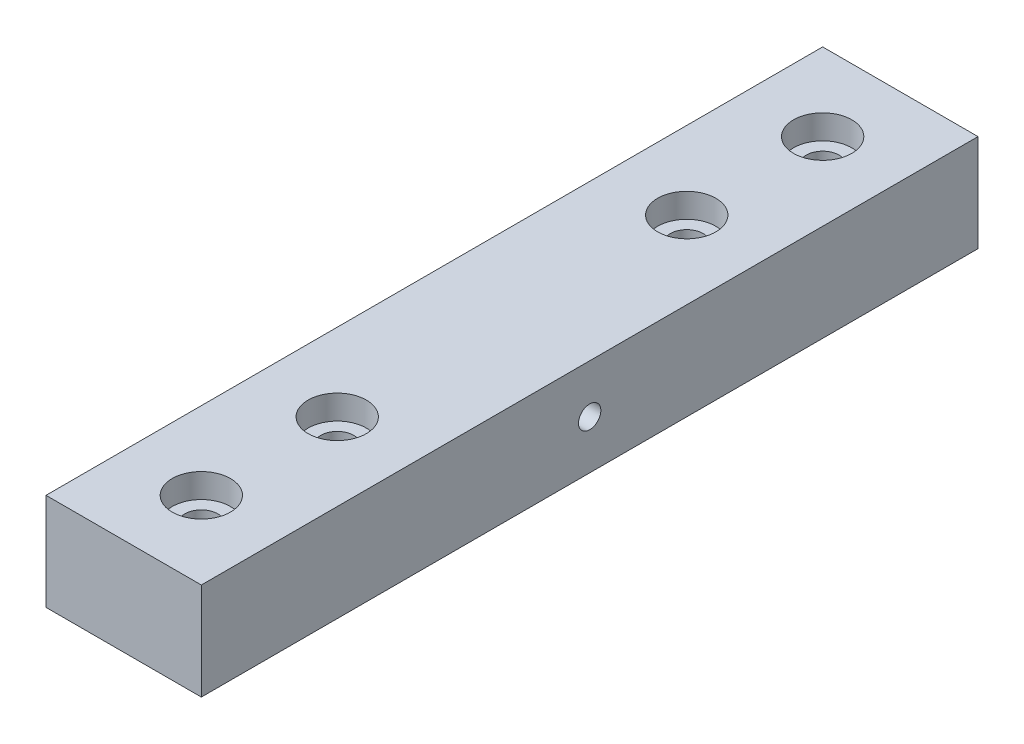
from build123d import *

# Parameters (mm, degrees)
SKETCH1_W           = 16
SKETCH1_H           = 80
BOSS_EXTRUDE1_DEPTH = 10
SKETCH2_R           = 2.35
CUT_EXTRUDE1_DEPTH  = 2.5
SKETCH2_3_R         = 1.7
CUT_EXTRUDE2_DEPTH  = 82.018516402
CUT_EXTRUDE3_START  = 7.5
SKETCH2_4_R         = 3
CUT_EXTRUDE3_DEPTH  = 74.518516402
SKETCH3_R           = 1.15
CUT_EXTRUDE4_DEPTH  = 83.194890352


with BuildPart() as part:
    # Sketch1 → Boss-Extrude1 (new body)
    with BuildSketch(Plane(origin=(0, 0, 0), x_dir=(1, 0, 0), z_dir=(0, 1, 0))):
        with Locations((0, 40)):
            Rectangle(SKETCH1_W, SKETCH1_H)
    extrude(amount=BOSS_EXTRUDE1_DEPTH)

    # Sketch2 → Cut-Extrude1 (cut)
    with BuildSketch(Plane(origin=(0, 0, 0), x_dir=(1, 0, 0), z_dir=(0, 1, 0))):
        with Locations((0, 72)):
            Circle(SKETCH2_R)
        with Locations((0, 58)):
            Circle(SKETCH2_R)
        with Locations((0, 22)):
            Circle(SKETCH2_R)
        with Locations((0, 8)):
            Circle(SKETCH2_R)
    extrude(amount=CUT_EXTRUDE1_DEPTH, mode=Mode.SUBTRACT)

    # Sketch2<3> → Cut-Extrude2 (cut, through all)
    with BuildSketch(Plane(origin=(0, 0, 0), x_dir=(1, 0, 0), z_dir=(0, 1, 0))):
        with Locations((0, 72)):
            Circle(SKETCH2_3_R)
        with Locations((0, 58)):
            Circle(SKETCH2_3_R)
        with Locations((0, 22)):
            Circle(SKETCH2_3_R)
        with Locations((0, 8)):
            Circle(SKETCH2_3_R)
    extrude(amount=CUT_EXTRUDE2_DEPTH, mode=Mode.SUBTRACT)

    # Sketch2<4> → Cut-Extrude3 (cut, through all)
    with BuildSketch(Plane(origin=(0, 0, 0), x_dir=(1, 0, 0), z_dir=(0, 1, 0)).offset(CUT_EXTRUDE3_START)):
        with Locations((0, 72)):
            Circle(SKETCH2_4_R)
        with Locations((0, 58)):
            Circle(SKETCH2_4_R)
        with Locations((0, 22)):
            Circle(SKETCH2_4_R)
        with Locations((0, 8)):
            Circle(SKETCH2_4_R)
    extrude(amount=CUT_EXTRUDE3_DEPTH, mode=Mode.SUBTRACT)

    # Sketch3 → Cut-Extrude4 (cut, through all)
    with BuildSketch(Plane(origin=(8, 0, 0), x_dir=(0, 0, -1), z_dir=(1, 0, 0))):
        with Locations((40, 5)):
            Circle(SKETCH3_R)
    extrude(amount=-CUT_EXTRUDE4_DEPTH, mode=Mode.SUBTRACT)


solid = part.part
